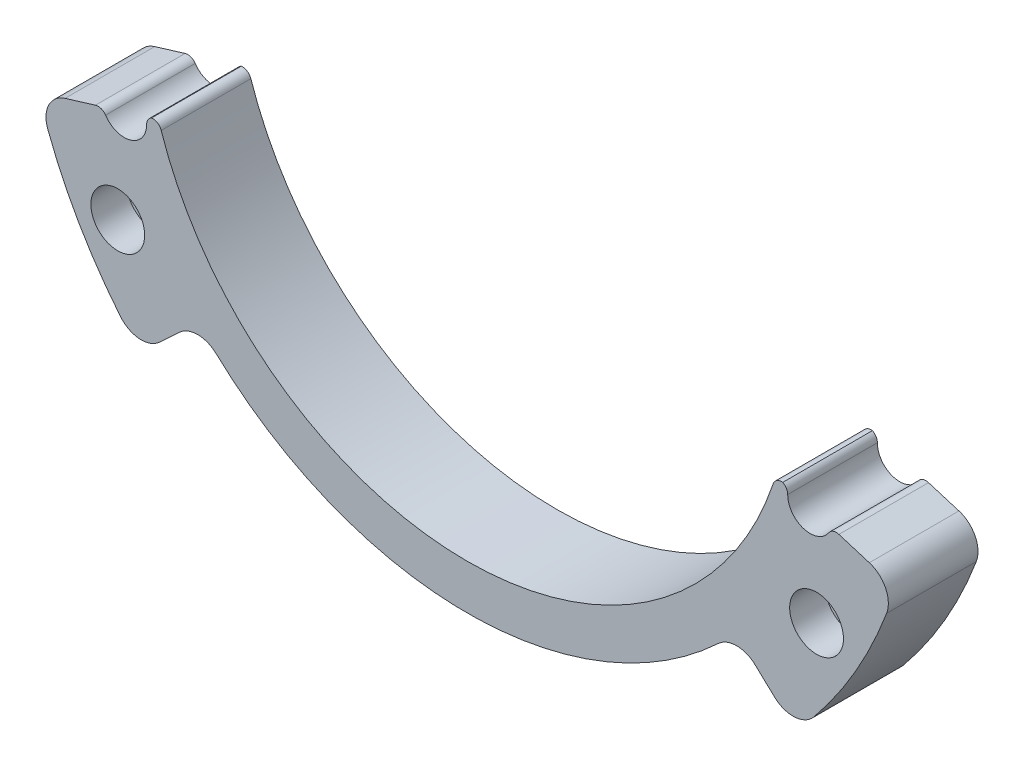
from build123d import *

# Parameters (mm, degrees)
SKETCH_1_R          = 1.6
EXTRUDE_1_DEPTH     = 10
SKETCH_2_R          = 2.5
CUT_EXTRUDE_1_DEPTH = 64.775363313
SKETCH_3_R          = 3
CUT_EXTRUDE_2_DEPTH = 4
FILLET_4_R          = 1
FILLET_5_R          = 3


with BuildPart() as part:
    # 草图1 → 凸台-拉伸1 (new body)
    with BuildSketch(Plane.XY):
        with BuildLine():
            Line((-34.426971215, -10.52538137), (-47.815237798, -14.618585236))
            ThreePointArc((-47.815237798, -14.618585236), (-43.301270189, -25), (-36.567685081, -34.099918003))
            Line((-36.567685081, -34.099918003), (-29.985501766, -27.961932763))
            ThreePointArc((-29.985501766, -27.961932763), (0, -41), (29.985501766, -27.961932763))
            Line((29.985501766, -27.961932763), (36.567685081, -34.099918003))
            ThreePointArc((36.567685081, -34.099918003), (43.301270189, -25), (47.815237798, -14.618585236))
            Line((47.815237798, -14.618585236), (34.426971215, -10.52538137))
            ThreePointArc((34.426971215, -10.52538137), (0, -36), (-34.426971215, -10.52538137))
        make_face()
        with Locations((-38.97114317, -22.5)):
            Circle(SKETCH_1_R, mode=Mode.SUBTRACT)
        with Locations((38.97114317, -22.5)):
            Circle(SKETCH_1_R, mode=Mode.SUBTRACT)
    extrude(amount=EXTRUDE_1_DEPTH)

    # 草图2 → 切除-拉伸1 (cut, through all)
    with BuildSketch(Plane.XY.offset(10)):
        with Locations((-38.252190239, -11.694868189)):
            Circle(SKETCH_2_R)
        with Locations((38.252190239, -11.694868189)):
            Circle(SKETCH_2_R)
    extrude(amount=-CUT_EXTRUDE_1_DEPTH, mode=Mode.SUBTRACT)

    # 草图3 → 切除-拉伸2 (cut)
    with BuildSketch(Plane.XY.offset(10)):
        with Locations((-38.97114317, -22.5)):
            Circle(SKETCH_3_R)
        with Locations((38.97114317, -22.5)):
            Circle(SKETCH_3_R)
    extrude(amount=-CUT_EXTRUDE_2_DEPTH, mode=Mode.SUBTRACT)

    # 圆角4
    # the kernel refuses this fillet: 1 mm, written as the material it takes off along each edge
    with BuildSketch(Plane(origin=(-34.426971215, -10.52538137, -2.466210045), x_dir=(-0.9563047559630324, -0.2923717047227467, 0), z_dir=(0, 0, 1))) as fillet_4_piece_1:
        with BuildLine():
            CenterArc((0.986484018, 1), FILLET_4_R, 181.548723167, 88.451276833)
            ThreePointArc((-0.013150685, 0.972972973), (-0.003287821, 0.486530921), (0, 0))
            Line((0, 0), (0.986484018, 0))
        make_face()
    extrude(amount=14.932420089, mode=Mode.SUBTRACT)
    with BuildSketch(Plane(origin=(34.426971215, -10.52538137, -2.466210045), x_dir=(-0.30526922048074906, -0.9522660883529749, 0), z_dir=(0, 0, 1))) as fillet_4_piece_2:
        with BuildLine():
            CenterArc((0.986576589, 0.999908672), FILLET_4_R, 180.774361584, 88.451276833)
            Line((-0.013332083, 0.986393924), (0, 0))
            ThreePointArc((0, 0), (0.486530921, 0.003287821), (0.973061841, 0))
        make_face()
    extrude(amount=14.932420089, mode=Mode.SUBTRACT)
    with BuildSketch(Plane(origin=(-40.642952128, -12.425797451, -2.135254916), x_dir=(0.42737008907787555, -0.9040767705021342, 0), z_dir=(0, 0, 1)), Plane(origin=(35.861428349, -10.963938927, -2.135254916), x_dir=(-0.1512474530257889, -0.9884959321885001, 0), z_dir=(0, 0, 1))) as fillet_4_piece_3:
        with BuildLine():
            CenterArc((0.866217493, -0.989523837), FILLET_4_R, 98.3007748, 73.398450401)
            Line((-0.123306344, -0.845154255), (0, 0))
            ThreePointArc((0, 0), (0.360923955, -0.026190408), (0.721847911, 0))
        make_face()
    extrude(amount=14.270509831, mode=Mode.SUBTRACT)
    with BuildSketch(Plane(origin=(-35.861428349, -10.963938927, -2.135254916), x_dir=(0.9563047559630329, 0.29237170472274493, 0), z_dir=(0, 0, 1)), Plane(origin=(40.642952128, -12.425797451, -2.135254916), x_dir=(0.9563047559630371, -0.2923717047227312, 0), z_dir=(0, 0, 1))) as fillet_4_piece_4:
        with BuildLine():
            CenterArc((0.854101966, -1), FILLET_4_R, 90, 73.398450401)
            ThreePointArc((-0.104212881, -0.714285714), (-0.026190408, -0.360923955), (0, 0))
            Line((0, 0), (0.854101966, 0))
        make_face()
    extrude(amount=14.270509831, mode=Mode.SUBTRACT)

    # 圆角5
    fillet_5_edges = [part.edges().sort_by_distance(p)[0] for p in [
        (-47.815237798, -14.618585236, 5),
        (47.815237798, -14.618585236, 5),
        (36.567685081, -34.099918003, 5),
        (29.985501766, -27.961932763, 5),
        (-29.985501766, -27.961932763, 5),
        (-36.567685081, -34.099918003, 5),
    ]]
    fillet(fillet_5_edges, radius=FILLET_5_R)


solid = part.part
